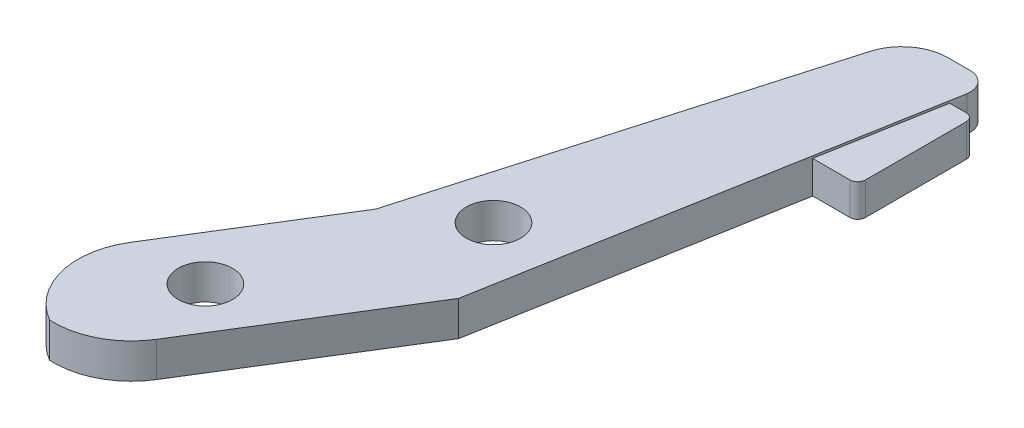
from build123d import *

# Parameters (mm, degrees)
BOSS_EXTRUDE1_DEPTH = 2.25
FILLET1_R           = 5
SKETCH2_R           = 1.75
CUT_EXTRUDE1_DEPTH  = 48.810012982
BOSS_EXTRUDE2_REACH = 42.044
SKETCH4_W           = 7.5
SKETCH4_H           = 2.1
SKETCH4_2_W         = 7.5
SKETCH4_2_H         = 2.1
BOSS_EXTRUDE3_DEPTH = 1.570511633
FILLET2_R           = 3
FILLET3_R           = 1.2
FILLET4_R           = 0.5


with BuildPart() as part:
    # Sketch1 → Boss-Extrude1 (new body)
    with BuildSketch(Plane(origin=(0, 0, 0), x_dir=(1, 0, 0), z_dir=(0, 1, 0))):
        Polygon((0, 0), (9.481214188, 15.300541739), (17.234295106, 42.205740796), (22.347489461, 42.205740796), (17.140904697, 12.99204844), (7.659690509, -2.308493299), align=None)
    extrude(amount=BOSS_EXTRUDE1_DEPTH)

    # Fillet1
    # the kernel refuses this fillet: 5 mm, written as the material it takes off along each edge
    with BuildSketch(Plane(origin=(7.659690509, -9.589301146, 2.308493299), x_dir=(0.5267341215597666, 0, -0.8500300966346198), z_dir=(0, 1, 0))) as fillet1_piece_1:
        with BuildLine():
            CenterArc((FILLET1_R * 0.767144091705, FILLET1_R), FILLET1_R, 195.013192562, 74.986807438)
            Line((-FILLET1_R * 0.19872211495, FILLET1_R * 0.740958553812), (0, 0))
            Line((0, 0), (FILLET1_R * 0.767144091705, 0))
        make_face()
    extrude(amount=21.428602293, mode=Mode.SUBTRACT)
    with BuildSketch(Plane(origin=(0, -16.294200966, 0), x_dir=(0.5267341215597675, 0, -0.8500300966346193), z_dir=(0, 1, 0))) as fillet1_piece_2:
        with BuildLine():
            CenterArc((FILLET1_R * 1.30353607727, -FILLET1_R), FILLET1_R, 90, 105.013192562)
            Line((FILLET1_R * 0.337669870614, -FILLET1_R * 1.25904144619), (0, 0))
            Line((0, 0), (FILLET1_R * 1.30353607727, 0))
        make_face()
    extrude(amount=34.838401932, mode=Mode.SUBTRACT)

    # Sketch2 → Cut-Extrude1 (cut, through all)
    with BuildSketch(Plane(origin=(0, 2.25, 0), x_dir=(1, 0, 0), z_dir=(0, 1, 0))):
        with Locations(Location((8.167211871, 5.629873064, 0), (0, 0, 270))):
            Circle(SKETCH2_R)
        with Locations(Location((14.031451824, 18.342492377, 0), (0, 0, 270))):
            Circle(SKETCH2_R)
    extrude(amount=-CUT_EXTRUDE1_DEPTH, mode=Mode.SUBTRACT)

    # Boss-Extrude2: up to this plane
    boss_extrude2_end = Plane(origin=(17.140904697, 2.25, -12.99204844), z_dir=(-0.9844866893056965, 0, -0.17545927897922378))
    # Sketch4 → Boss-Extrude2 (add, up to the surface)
    with BuildSketch(Plane(origin=(23.5, -1.484709168, -8.201879583), x_dir=(0, 0, -1), z_dir=(1, 0, 0)), mode=Mode.PRIVATE) as boss_extrude2_sk1:
        with Locations((27.908493587, 2.541926215)):
            Rectangle(SKETCH4_W, SKETCH4_H)
    boss_extrude2_tool1 = split(extrude(boss_extrude2_sk1.sketch, amount=-BOSS_EXTRUDE2_REACH, mode=Mode.PRIVATE), bisect_by=boss_extrude2_end, keep=Keep.BOTH, mode=Mode.PRIVATE)
    add(boss_extrude2_tool1.solids().sort_by_distance((23.5, 1.057217, -36.110373))[0])

    # Sketch4<2> → Boss-Extrude3 (add)
    with BuildSketch(Plane(origin=(23.5, -1.484709168, -8.201879583), x_dir=(0, 0, -1), z_dir=(1, 0, 0))):
        with Locations((27.908493587, 2.541926215)):
            Rectangle(SKETCH4_2_W, SKETCH4_2_H)
    extrude(amount=-BOSS_EXTRUDE3_DEPTH)

    # Fillet2
    fillet2_edges = [part.edges().sort_by_distance(p)[0] for p in [
        (17.234295106, 1.125, -42.205740796),
    ]]
    fillet(fillet2_edges, radius=FILLET2_R)

    # Fillet3
    fillet3_edges = [part.edges().sort_by_distance(p)[0] for p in [
        (22.347489461, 1.125, -42.205740796),
    ]]
    fillet(fillet3_edges, radius=FILLET3_R)

    # Fillet4
    fillet4_edges = [part.edges().sort_by_distance(p)[0] for p in [
        (23.5, 1.057217047, -39.86037317),
        (23.5, 1.057217047, -32.36037317),
    ]]
    fillet(fillet4_edges, radius=FILLET4_R)


solid = part.part
